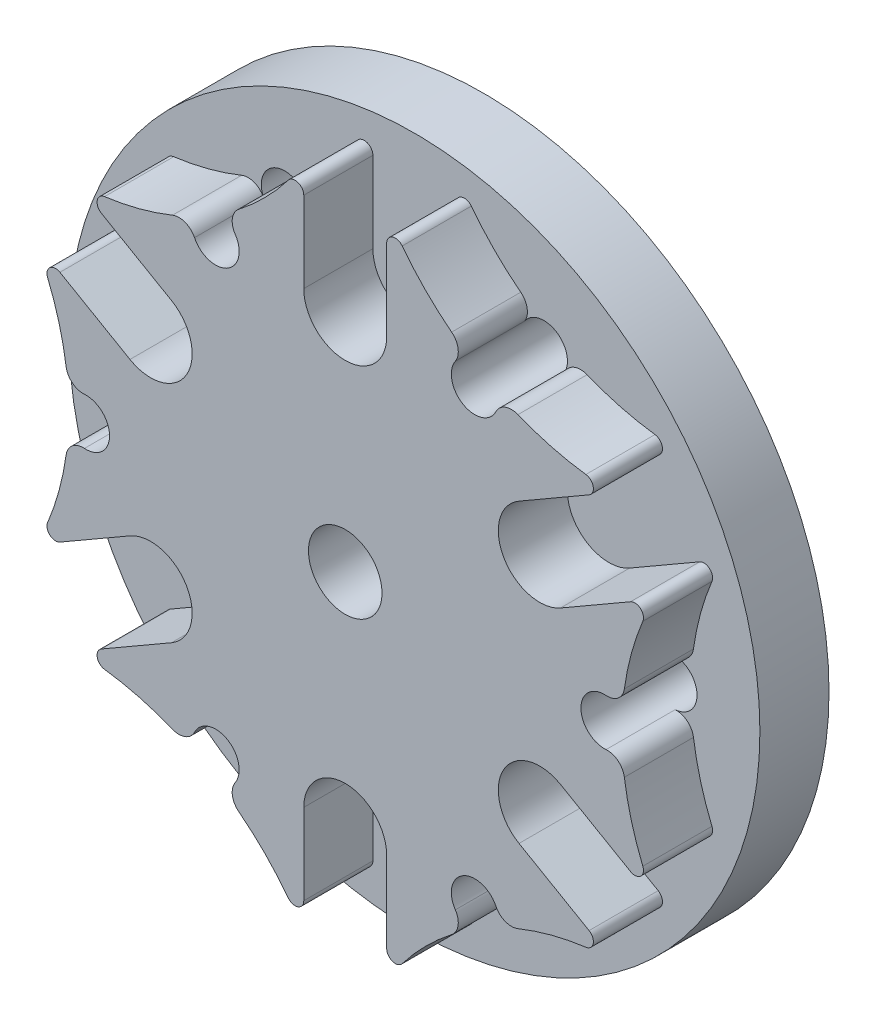
from build123d import *

# Parameters (mm, degrees)
SKETCH2_R           = 31.75
BOSS_EXTRUDE1_DEPTH = 6.35
BOSS_EXTRUDE2_DEPTH = 6.35
SKETCH4_R           = 3.3782
CUT_EXTRUDE1_DEPTH  = 47.6627796
FILLET2_R           = 0.79375
SKETCH5_R           = 2.159
CUT_EXTRUDE2_DEPTH  = 47.6627796
FILLET3_R           = 1.5875


with BuildPart() as part:
    # Sketch2 → Boss-Extrude1 (new body)
    with BuildSketch(Plane.XY):
        Circle(SKETCH2_R)
    extrude(amount=BOSS_EXTRUDE1_DEPTH)

    # Sketch3 → Boss-Extrude2 (add)
    with BuildSketch(Plane.XY.offset(6.35)):
        with BuildLine():
            Line((3.81, 30.613810246), (3.81, 20.6375))
            ThreePointArc((3.81, 20.6375), (0, 16.8275), (-3.81, 20.6375))
            Line((-3.81, 20.6375), (-3.81, 30.613810246))
            ThreePointArc((-3.81, 30.613810246), (-12.7, 21.997045256), (-24.60733738, 18.606461911))
            Line((-24.60733738, 18.606461911), (-15.967599271, 13.618306788))
            ThreePointArc((-15.967599271, 13.618306788), (-14.573042482, 8.41375), (-19.777599271, 7.019193212))
            Line((-19.777599271, 7.019193212), (-28.41733738, 12.007348335))
            ThreePointArc((-28.41733738, 12.007348335), (-25.4, 0), (-28.41733738, -12.007348335))
            Line((-28.41733738, -12.007348335), (-19.777599271, -7.019193212))
            ThreePointArc((-19.777599271, -7.019193212), (-14.573042482, -8.41375), (-15.967599271, -13.618306788))
            Line((-15.967599271, -13.618306788), (-24.60733738, -18.606461911))
            ThreePointArc((-24.60733738, -18.606461911), (-12.7, -21.997045256), (-3.81, -30.613810246))
            Line((-3.81, -30.613810246), (-3.81, -20.6375))
            ThreePointArc((-3.81, -20.6375), (0, -16.8275), (3.81, -20.6375))
            Line((3.81, -20.6375), (3.81, -30.613810246))
            ThreePointArc((3.81, -30.613810246), (12.7, -21.997045256), (24.60733738, -18.606461911))
            Line((24.60733738, -18.606461911), (15.967599271, -13.618306788))
            ThreePointArc((15.967599271, -13.618306788), (14.573042482, -8.41375), (19.777599271, -7.019193212))
            Line((19.777599271, -7.019193212), (28.41733738, -12.007348335))
            ThreePointArc((28.41733738, -12.007348335), (25.4, 0), (28.41733738, 12.007348335))
            Line((28.41733738, 12.007348335), (19.777599271, 7.019193212))
            ThreePointArc((19.777599271, 7.019193212), (14.573042482, 8.41375), (15.967599271, 13.618306788))
            Line((15.967599271, 13.618306788), (24.60733738, 18.606461911))
            ThreePointArc((24.60733738, 18.606461911), (12.7, 21.997045256), (3.81, 30.613810246))
        make_face()
    extrude(amount=BOSS_EXTRUDE2_DEPTH)

    # Sketch4 → Cut-Extrude1 (cut, through all)
    with BuildSketch(Plane.XY.offset(12.7)):
        Circle(SKETCH4_R)
    extrude(amount=-CUT_EXTRUDE1_DEPTH, mode=Mode.SUBTRACT)

    # Fillet2
    fillet2_edges = [part.edges().sort_by_distance(p)[0] for p in [
        (-28.41733738, 12.007348335, 9.525),
        (-28.41733738, -12.007348335, 9.525),
        (-24.60733738, -18.606461911, 9.525),
        (-3.81, -30.613810246, 9.525),
        (3.81, -30.613810246, 9.525),
        (24.60733738, -18.606461911, 9.525),
        (28.41733738, -12.007348335, 9.525),
        (28.41733738, 12.007348335, 9.525),
        (24.60733738, 18.606461911, 9.525),
        (3.81, 30.613810246, 9.525),
        (-3.81, 30.613810246, 9.525),
        (-24.60733738, 18.606461911, 9.525),
    ]]
    fillet(fillet2_edges, radius=FILLET2_R)

    # Sketch5 → Cut-Extrude2 (cut, through all)
    with BuildSketch(Plane(origin=(0, 0, 0), x_dir=(-1, 0, 0), z_dir=(0, 0, -1))):
        with Locations((-11.90625, 20.622229928)):
            Circle(SKETCH5_R)
        with Locations((11.90625, 20.622229928)):
            Circle(SKETCH5_R)
        with Locations((23.8125, 0)):
            Circle(SKETCH5_R)
        with Locations((11.90625, -20.622229928)):
            Circle(SKETCH5_R)
        with Locations((-11.90625, -20.622229928)):
            Circle(SKETCH5_R)
        with Locations((-23.8125, 0)):
            Circle(SKETCH5_R)
    extrude(amount=-CUT_EXTRUDE2_DEPTH, mode=Mode.SUBTRACT)

    # Fillet3
    # the kernel refuses this fillet: 1.5875 mm, written as the material it takes off along each edge
    with BuildSketch(Plane(origin=(25.439668824, 1.419014665, 17.971488678), x_dir=(-0.8953649723474578, 0.44533309588805103, 0), z_dir=(0, 0, -1)), Plane(origin=(13.94873716, -21.321892132, 17.971488678), x_dir=(-0.06201271198897514, 0.9980753596556587, 0), z_dir=(0, 0, -1)), Plane(origin=(-11.490931663, -22.740906798, 17.971488678), x_dir=(0.8333522603583458, 0.5527422637682374, 0), z_dir=(0, 0, -1)), Plane(origin=(-25.439668824, -1.419014665, 17.971488678), x_dir=(0.8953649723478783, -0.4453330958872058, 0), z_dir=(0, 0, -1)), Plane(origin=(-13.94873716, 21.321892132, 17.971488678), x_dir=(0.062012711989375524, -0.9980753596556338, 0), z_dir=(0, 0, -1)), Plane(origin=(11.490931663, 22.740906798, 17.971488678), x_dir=(-0.833352260358639, -0.5527422637677954, 0), z_dir=(0, 0, -1))) as fillet3_piece_1:
        with BuildLine():
            CenterArc((2.256551384, 1.467035409), FILLET3_R, 161.515751163, 86.019798363)
            ThreePointArc((0.75094916, 1.970342665), (0.395929534, 0.977375414), (0, 0))
            ThreePointArc((0, 0), (0.824975775, 0.163831844), (1.64995155, 0))
        make_face()
    extrude(amount=11.621488678, mode=Mode.SUBTRACT)
    with BuildSketch(Plane(origin=(25.439668824, -1.419014665, 17.971488678), x_dir=(0.0972615315412338, -0.9952588580275252, 0), z_dir=(0, 0, -1)), Plane(origin=(11.490931663, -22.740906798, 17.971488678), x_dir=(-0.8132886886226869, -0.5818603861394845, 0), z_dir=(0, 0, -1)), Plane(origin=(-13.94873716, -21.321892132, 17.971488678), x_dir=(-0.9105502201639706, 0.4133984718880137, 0), z_dir=(0, 0, -1)), Plane(origin=(-25.439668824, 1.419014665, 17.971488678), x_dir=(-0.09726153154127824, 0.9952588580275209, 0), z_dir=(0, 0, -1)), Plane(origin=(-11.490931663, 22.740906798, 17.971488678), x_dir=(0.8132886886227111, 0.5818603861394509, 0), z_dir=(0, 0, -1)), Plane(origin=(13.94873716, 21.321892132, 17.971488678), x_dir=(0.9105502201639338, -0.41339847188809425, 0), z_dir=(0, 0, -1))) as fillet3_piece_2:
        with BuildLine():
            CenterArc((2.17448908, 1.586131862), FILLET3_R, 181.601297313, 86.019798363)
            ThreePointArc((0.587609026, 1.541770329), (0.446894509, 0.71253856), (0, 0))
            ThreePointArc((0, 0), (1.054297736, 0.021890215), (2.108595471, 0))
        make_face()
    extrude(amount=11.621488678, mode=Mode.SUBTRACT)


solid = part.part
